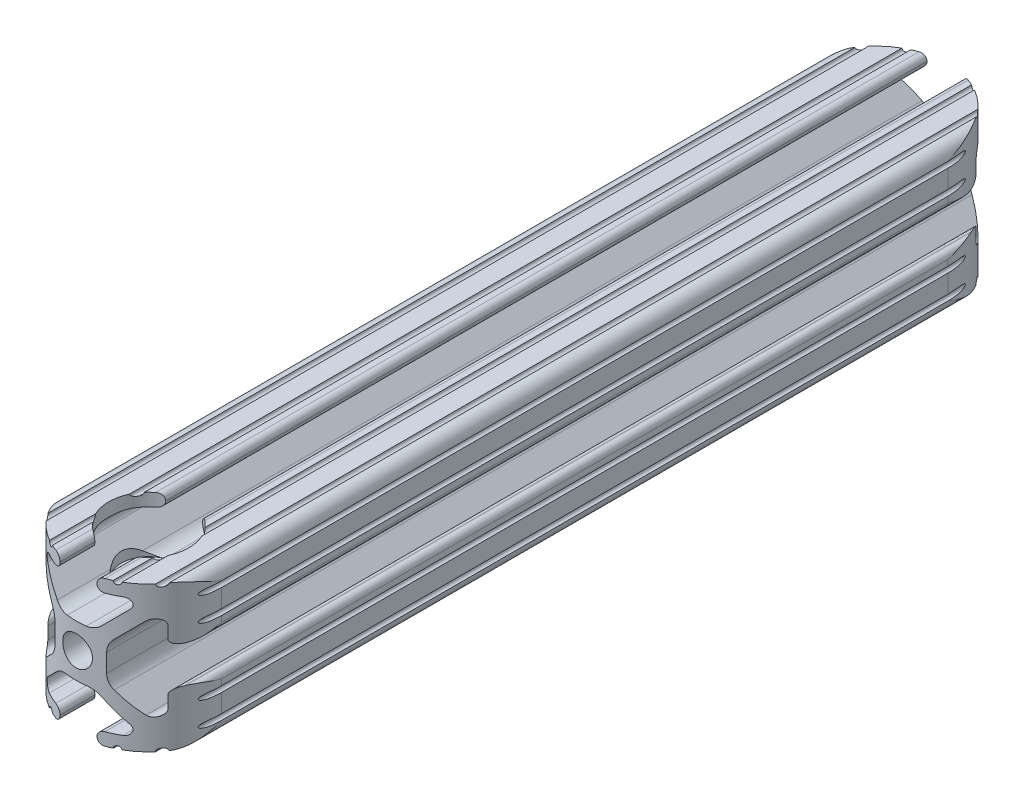
from build123d import *

# Parameters (mm, degrees)
SKETCH1_R               = 2.6035
BOSS_EXTRUDE1_DEPTH     = 76.2
CUT_EXTRUDE1_DEPTH      = 82.319677815
CUT_EXTRUDE1_DEPTH_BACK = 82.319677815
CUT_EXTRUDE2_OUTLINE_W  = 6.985
CUT_EXTRUDE2_OUTLINE_H  = 2.343412187
CUT_EXTRUDE4_START      = -21.424392
SKETCH3_3_R             = 6.985
CUT_EXTRUDE4_DEPTH      = 3.975608
SKETCH3_5_R             = 4.8006
CUT_EXTRUDE5_DEPTH      = 8.2042
CUT_EXTRUDE6_START      = -17.1958
SKETCH3_6_R             = 4.8006
CUT_EXTRUDE6_DEPTH      = 8.2042


# Read off the part's stored shape, not the designer's step: Cut-Extrude2
with BuildPart() as part:
    # Sketch1 → Boss-Extrude1 (new, symmetric)
    with BuildSketch(Plane.XY):
        with BuildLine():
            Line((-7.179650497, -8.645192506), (-3.952270251, -5.423690499))
            ThreePointArc((-3.952270251, -5.423690499), (-2.922936451, -4.736929036), (-1.709253557, -4.4958))
            Line((-1.709253557, -4.4958), (1.709253557, -4.4958))
            ThreePointArc((1.709253557, -4.4958), (2.922936451, -4.736929036), (3.952270251, -5.423690499))
            Line((3.952270251, -5.423690499), (7.179650497, -8.645192506))
            ThreePointArc((7.179650497, -8.645192506), (7.41473083, -9.822813117), (6.416408329, -10.4902))
            Line((6.416408329, -10.4902), (4.287512407, -10.4902))
            ThreePointArc((4.287512407, -10.4902), (3.54574862, -10.79744862), (3.2385, -11.539212407))
            Line((3.2385, -11.539212407), (3.2385, -11.650987593))
            ThreePointArc((3.2385, -11.650987593), (3.54574862, -12.39275138), (4.287512407, -12.7))
            Line((4.287512407, -12.7), (5.317126718, -12.7))
            ThreePointArc((5.317126718, -12.7), (5.825126718, -12.192), (6.333126718, -12.7))
            Line((6.333126718, -12.7), (9.550443118, -12.7))
            ThreePointArc((9.550443118, -12.7), (10.058366869, -12.192000006), (10.566443095, -12.699847501))
            ThreePointArc((10.566443095, -12.699847501), (12.082537762, -12.08250727), (12.699846982, -10.566399977))
            ThreePointArc((12.699846982, -10.566399977), (12.192000006, -10.058323491), (12.7, -9.5504))
            Line((12.7, -9.5504), (12.7, -6.3330836))
            ThreePointArc((12.7, -6.3330836), (12.192, -5.8250836), (12.7, -5.3170836))
            Line((12.7, -5.3170836), (12.7, -4.287469289))
            ThreePointArc((12.7, -4.287469289), (12.39275138, -3.545705502), (11.650987593, -3.238456882))
            Line((11.650987593, -3.238456882), (11.539212407, -3.238456882))
            ThreePointArc((11.539212407, -3.238456882), (10.79744862, -3.545705502), (10.4902, -4.287469289))
            Line((10.4902, -4.287469289), (10.4902, -6.402089023))
            ThreePointArc((10.4902, -6.402089023), (9.856505071, -7.351067942), (8.737131347, -7.129408934))
            Line((8.737131347, -7.129408934), (5.441005833, -3.840816462))
            ThreePointArc((5.441005833, -3.840816462), (4.750877967, -2.809883091), (4.5085, -1.593185507))
            Line((4.5085, -1.593185507), (4.5085, 1.593185507))
            ThreePointArc((4.5085, 1.593185507), (4.750877967, 2.809883091), (5.441005833, 3.840816462))
            Line((5.441005833, 3.840816462), (8.737131347, 7.129408934))
            ThreePointArc((8.737131347, 7.129408934), (9.856505071, 7.351067942), (10.4902, 6.402089023))
            Line((10.4902, 6.402089023), (10.4902, 4.287469289))
            ThreePointArc((10.4902, 4.287469289), (10.79744862, 3.545705502), (11.539212407, 3.238456882))
            Line((11.539212407, 3.238456882), (11.650987593, 3.238456882))
            ThreePointArc((11.650987593, 3.238456882), (12.39275138, 3.545705502), (12.7, 4.287469289))
            Line((12.7, 4.287469289), (12.7, 5.3170836))
            ThreePointArc((12.7, 5.3170836), (12.192, 5.8250836), (12.7, 6.3330836))
            Line((12.7, 6.3330836), (12.7, 9.5504))
            ThreePointArc((12.7, 9.5504), (12.192000006, 10.058323491), (12.699846982, 10.566399977))
            ThreePointArc((12.699846982, 10.566399977), (12.082537762, 12.08250727), (10.566443095, 12.699847501))
            ThreePointArc((10.566443095, 12.699847501), (10.058366869, 12.192000006), (9.550443118, 12.7))
            Line((9.550443118, 12.7), (6.333126718, 12.7))
            ThreePointArc((6.333126718, 12.7), (5.825126718, 12.192), (5.317126718, 12.7))
            Line((5.317126718, 12.7), (4.287512407, 12.7))
            ThreePointArc((4.287512407, 12.7), (3.54574862, 12.39275138), (3.2385, 11.650987593))
            Line((3.2385, 11.650987593), (3.2385, 11.539212407))
            ThreePointArc((3.2385, 11.539212407), (3.54574862, 10.79744862), (4.287512407, 10.4902))
            Line((4.287512407, 10.4902), (6.476788598, 10.4902))
            ThreePointArc((6.476788598, 10.4902), (7.432222385, 9.85140422), (7.207036008, 8.724370562))
            Line((7.207036008, 8.724370562), (3.898272566, 5.423169045))
            ThreePointArc((3.898272566, 5.423169045), (2.869120213, 4.736787962), (1.655778399, 4.4958))
            Line((1.655778399, 4.4958), (-1.655778399, 4.4958))
            ThreePointArc((-1.655778399, 4.4958), (-2.869120213, 4.736787962), (-3.898272566, 5.423169045))
            Line((-3.898272566, 5.423169045), (-7.207036008, 8.724370562))
            ThreePointArc((-7.207036008, 8.724370562), (-7.432222385, 9.85140422), (-6.476788598, 10.4902))
            Line((-6.476788598, 10.4902), (-4.287512407, 10.4902))
            ThreePointArc((-4.287512407, 10.4902), (-3.54574862, 10.79744862), (-3.2385, 11.539212407))
            Line((-3.2385, 11.539212407), (-3.2385, 11.650987593))
            ThreePointArc((-3.2385, 11.650987593), (-3.54574862, 12.39275138), (-4.287512407, 12.7))
            Line((-4.287512407, 12.7), (-5.317126718, 12.7))
            ThreePointArc((-5.317126718, 12.7), (-5.825126718, 12.192), (-6.333126718, 12.7))
            Line((-6.333126718, 12.7), (-9.550443118, 12.7))
            ThreePointArc((-9.550443118, 12.7), (-10.058366869, 12.192000006), (-10.566443095, 12.699847501))
            ThreePointArc((-10.566443095, 12.699847501), (-12.082537762, 12.08250727), (-12.699846982, 10.566399977))
            ThreePointArc((-12.699846982, 10.566399977), (-12.192000006, 10.058323491), (-12.7, 9.5504))
            Line((-12.7, 9.5504), (-12.7, 6.3330836))
            ThreePointArc((-12.7, 6.3330836), (-12.192, 5.8250836), (-12.7, 5.3170836))
            Line((-12.7, 5.3170836), (-12.7, 4.287469289))
            ThreePointArc((-12.7, 4.287469289), (-12.39275138, 3.545705502), (-11.650987593, 3.238456882))
            Line((-11.650987593, 3.238456882), (-11.539212407, 3.238456882))
            ThreePointArc((-11.539212407, 3.238456882), (-10.79744862, 3.545705502), (-10.4902, 4.287469289))
            Line((-10.4902, 4.287469289), (-10.4902, 6.402089023))
            ThreePointArc((-10.4902, 6.402089023), (-9.856505071, 7.351067942), (-8.737131347, 7.129408934))
            Line((-8.737131347, 7.129408934), (-5.441005833, 3.840816462))
            ThreePointArc((-5.441005833, 3.840816462), (-4.750877967, 2.809883091), (-4.5085, 1.593185507))
            Line((-4.5085, 1.593185507), (-4.5085, -1.593185507))
            ThreePointArc((-4.5085, -1.593185507), (-4.750877967, -2.809883091), (-5.441005833, -3.840816462))
            Line((-5.441005833, -3.840816462), (-8.737131347, -7.129408934))
            ThreePointArc((-8.737131347, -7.129408934), (-9.856505071, -7.351067942), (-10.4902, -6.402089023))
            Line((-10.4902, -6.402089023), (-10.4902, -4.287469289))
            ThreePointArc((-10.4902, -4.287469289), (-10.79744862, -3.545705502), (-11.539212407, -3.238456882))
            Line((-11.539212407, -3.238456882), (-11.650987593, -3.238456882))
            ThreePointArc((-11.650987593, -3.238456882), (-12.39275138, -3.545705502), (-12.7, -4.287469289))
            Line((-12.7, -4.287469289), (-12.7, -5.3170836))
            ThreePointArc((-12.7, -5.3170836), (-12.192, -5.8250836), (-12.7, -6.3330836))
            Line((-12.7, -6.3330836), (-12.7, -9.5504))
            ThreePointArc((-12.7, -9.5504), (-12.192000006, -10.058323491), (-12.699846982, -10.566399977))
            ThreePointArc((-12.699846982, -10.566399977), (-12.082537762, -12.08250727), (-10.566443095, -12.699847501))
            ThreePointArc((-10.566443095, -12.699847501), (-10.058366869, -12.192000006), (-9.550443118, -12.7))
            Line((-9.550443118, -12.7), (-6.333126718, -12.7))
            ThreePointArc((-6.333126718, -12.7), (-5.825126718, -12.192), (-5.317126718, -12.7))
            Line((-5.317126718, -12.7), (-4.287512407, -12.7))
            ThreePointArc((-4.287512407, -12.7), (-3.54574862, -12.39275138), (-3.2385, -11.650987593))
            Line((-3.2385, -11.650987593), (-3.2385, -11.539212407))
            ThreePointArc((-3.2385, -11.539212407), (-3.54574862, -10.79744862), (-4.287512407, -10.4902))
            Line((-4.287512407, -10.4902), (-6.416408329, -10.4902))
            ThreePointArc((-6.416408329, -10.4902), (-7.41473083, -9.822813117), (-7.179650497, -8.645192506))
        make_face()
        with Locations(Location((0, 0, 0), (0, 0, 180))):
            Circle(SKETCH1_R, mode=Mode.SUBTRACT)
    extrude(amount=BOSS_EXTRUDE1_DEPTH, both=True)

    # Sketch2 → Cut-Extrude1 (cut, two sides: drawn at the far end of the back side and taken through both)
    with BuildSketch(Plane(origin=(0, 12.7, 0), x_dir=(1, 0, 0), z_dir=(0, 1, 0)).offset(-CUT_EXTRUDE1_DEPTH_BACK)):
        with BuildLine():
            ThreePointArc((3.175, -63.5), (2.24506403, -61.25493597), (0, -60.325))
            Line((0, -60.325), (0, -66.675))
            ThreePointArc((0, -66.675), (2.24506403, -65.74506403), (3.175, -63.5))
        make_face()
        with BuildLine():
            Line((0, -66.675), (0, -60.325))
            ThreePointArc((0, -60.325), (-3.175, -63.5), (0, -66.675))
        make_face()
        with BuildLine():
            ThreePointArc((-9.550443118, -71.871322252), (-11.886560217, -67.972100871), (-12.7, -63.5))
            Line((-12.7, -63.5), (-12.7, -76.2))
            Line((-12.7, -76.2), (-9.550443118, -76.2))
            Line((-9.550443118, -76.2), (-9.550443118, -71.871322252))
        make_face()
        with BuildLine():
            Line((-6.333126718, -76.2), (-6.333126718, -74.50824718))
            ThreePointArc((-6.333126718, -74.50824718), (-8.050483896, -73.322408515), (-9.550443118, -71.871322252))
            Line((-9.550443118, -71.871322252), (-9.550443118, -76.2))
            Line((-9.550443118, -76.2), (-6.333126718, -76.2))
        make_face()
        with BuildLine():
            Line((-6.333126718, -76.2), (0, -76.2))
            ThreePointArc((0, -76.2), (-3.277595217, -75.769774635), (-6.333126718, -74.50824718))
            Line((-6.333126718, -74.50824718), (-6.333126718, -76.2))
        make_face()
        with BuildLine():
            Line((12.7, -76.2), (12.7, -63.5))
            ThreePointArc((12.7, -63.5), (8.980256121, -72.480256121), (0, -76.2))
            Line((0, -76.2), (12.7, -76.2))
        make_face()
        with BuildLine():
            Line((12.7, 76.2), (0, 76.2))
            ThreePointArc((0, 76.2), (8.980256121, 72.480256121), (12.7, 63.5))
            Line((12.7, 63.5), (12.7, 76.2))
        make_face()
        with BuildLine():
            Line((-6.333126718, 74.50824718), (-6.333126718, 76.2))
            Line((-6.333126718, 76.2), (-9.550443118, 76.2))
            Line((-9.550443118, 76.2), (-9.550443118, 71.871322252))
            ThreePointArc((-9.550443118, 71.871322252), (-8.050483896, 73.322408515), (-6.333126718, 74.50824718))
        make_face()
        with BuildLine():
            ThreePointArc((-6.333126718, 74.50824718), (-3.277595217, 75.769774635), (0, 76.2))
            Line((0, 76.2), (-6.333126718, 76.2))
            Line((-6.333126718, 76.2), (-6.333126718, 74.50824718))
        make_face()
        with BuildLine():
            Line((-9.550443118, 71.871322252), (-9.550443118, 76.2))
            Line((-9.550443118, 76.2), (-12.7, 76.2))
            Line((-12.7, 76.2), (-12.7, 63.5))
            ThreePointArc((-12.7, 63.5), (-11.886560217, 67.972100871), (-9.550443118, 71.871322252))
        make_face()
    extrude(amount=CUT_EXTRUDE1_DEPTH + CUT_EXTRUDE1_DEPTH_BACK, mode=Mode.SUBTRACT)

    # Cut-Extrude2 outline → Cut-Extrude2 (revolve, cut)
    with BuildSketch(Plane.XY.offset(63.5)):
        with Locations((3.4925, 11.528293931)):
            Rectangle(CUT_EXTRUDE2_OUTLINE_W, CUT_EXTRUDE2_OUTLINE_H)
    revolve(axis=Axis((0, 0, 63.5), (0, 1, 0)), mode=Mode.SUBTRACT)

    # Sketch3<3> → Cut-Extrude4 (cut)
    with BuildSketch(Plane(origin=(0, 12.7, 0), x_dir=(1, 0, 0), z_dir=(0, 1, 0)).offset(CUT_EXTRUDE4_START)):
        with Locations((0, -63.5)):
            Circle(SKETCH3_3_R)
    extrude(amount=-CUT_EXTRUDE4_DEPTH, mode=Mode.SUBTRACT)

    # Sketch3<5> → Cut-Extrude5 (cut)
    with BuildSketch(Plane(origin=(0, 12.7, 0), x_dir=(1, 0, 0), z_dir=(0, 1, 0))):
        with Locations((0, -63.5)):
            Circle(SKETCH3_5_R)
    extrude(amount=-CUT_EXTRUDE5_DEPTH, mode=Mode.SUBTRACT)

    # Sketch3<6> → Cut-Extrude6 (cut)
    with BuildSketch(Plane(origin=(0, 12.7, 0), x_dir=(1, 0, 0), z_dir=(0, 1, 0)).offset(CUT_EXTRUDE6_START)):
        with Locations((0, -63.5)):
            Circle(SKETCH3_6_R)
    extrude(amount=-CUT_EXTRUDE6_DEPTH, mode=Mode.SUBTRACT)


solid = part.part
